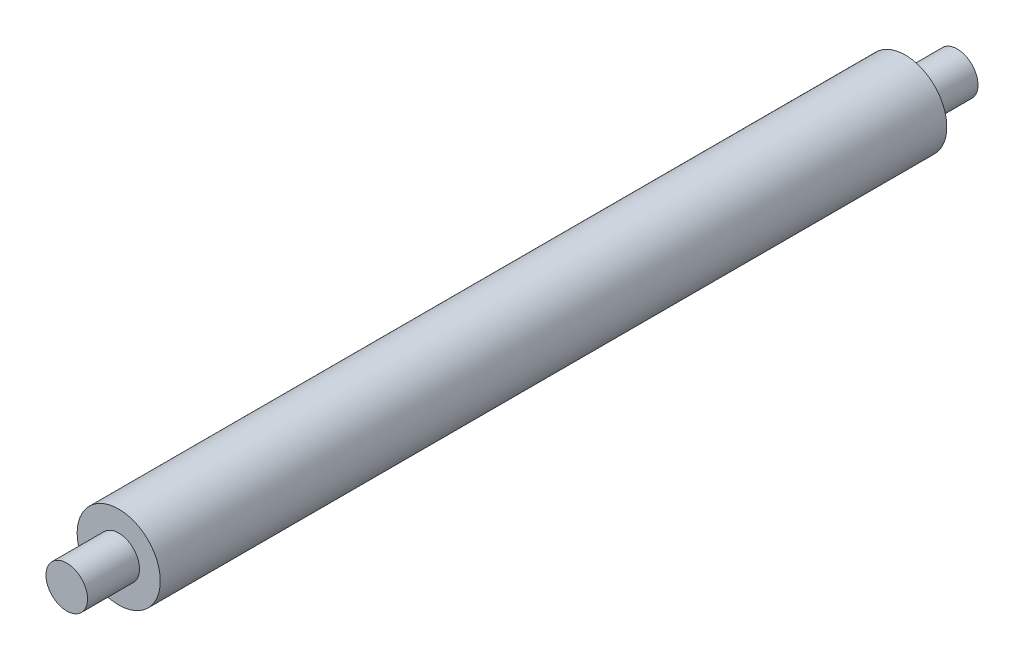
from build123d import *

# Parameters (mm, degrees)
SKETCH1_R           = 6
BOSS_EXTRUDE1_DEPTH = 56.75
SKETCH2_R           = 3
BOSS_EXTRUDE2_DEPTH = 7.5
BOSS_EXTRUDE3_START = 7.5
SKETCH3_R           = 3
BOSS_EXTRUDE3_DEPTH = 7.5


with BuildPart() as part:
    # Sketch1 → Boss-Extrude1 (new, symmetric)
    with BuildSketch(Plane.XY):
        Circle(SKETCH1_R)
    extrude(amount=BOSS_EXTRUDE1_DEPTH, both=True)

    # Sketch2 → Boss-Extrude2 (add)
    with BuildSketch(Plane.XY.offset(56.75)):
        Circle(SKETCH2_R)
    extrude(amount=BOSS_EXTRUDE2_DEPTH)

    # Sketch3 → Boss-Extrude3 (add)
    with BuildSketch(Plane(origin=(0, 0, -56.75), x_dir=(-1, 0, 0), z_dir=(0, 0, -1)).offset(BOSS_EXTRUDE3_START)):
        Circle(SKETCH3_R)
    extrude(amount=-BOSS_EXTRUDE3_DEPTH)


solid = part.part
